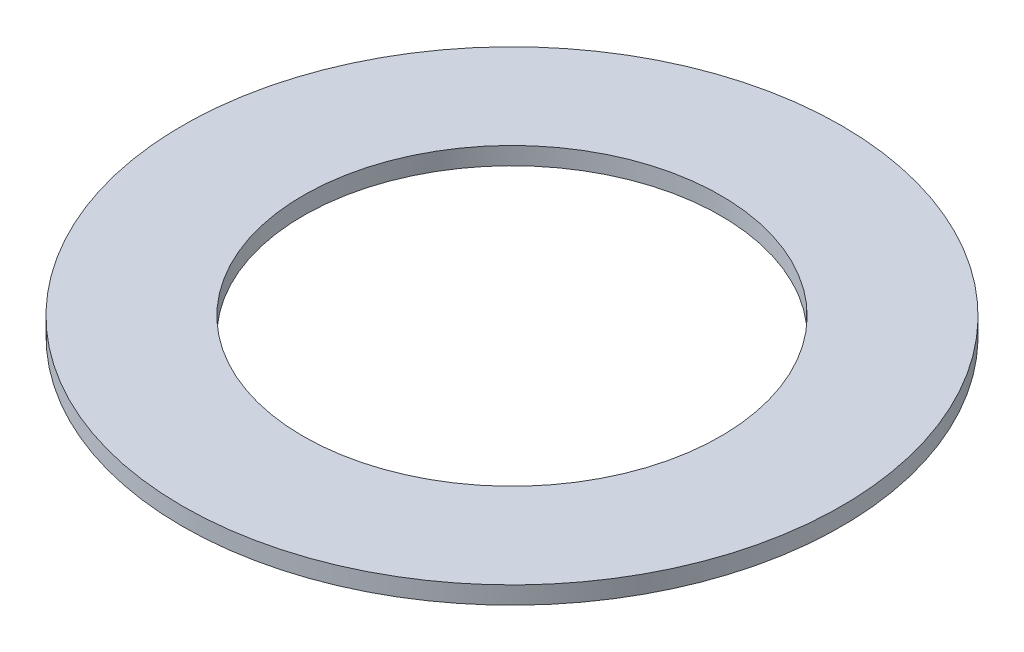
from build123d import *

# Parameters (mm, degrees)
SKETCH1_R           = 75
BOSS_EXTRUDE1_DEPTH = 4
SKETCH2_R           = 47.5
CUT_EXTRUDE1_DEPTH  = 107.141415103


with BuildPart() as part:
    # Sketch1 → Boss-Extrude1 (new body)
    with BuildSketch(Plane(origin=(0, 0, 0), x_dir=(1, 0, 0), z_dir=(0, 1, 0))):
        Circle(SKETCH1_R)
    extrude(amount=BOSS_EXTRUDE1_DEPTH)

    # Sketch2 → Cut-Extrude1 (cut, through all)
    with BuildSketch(Plane(origin=(0, 0, 0), x_dir=(1, 0, 0), z_dir=(0, 1, 0))):
        Circle(SKETCH2_R)
    extrude(amount=CUT_EXTRUDE1_DEPTH, mode=Mode.SUBTRACT)


solid = part.part
